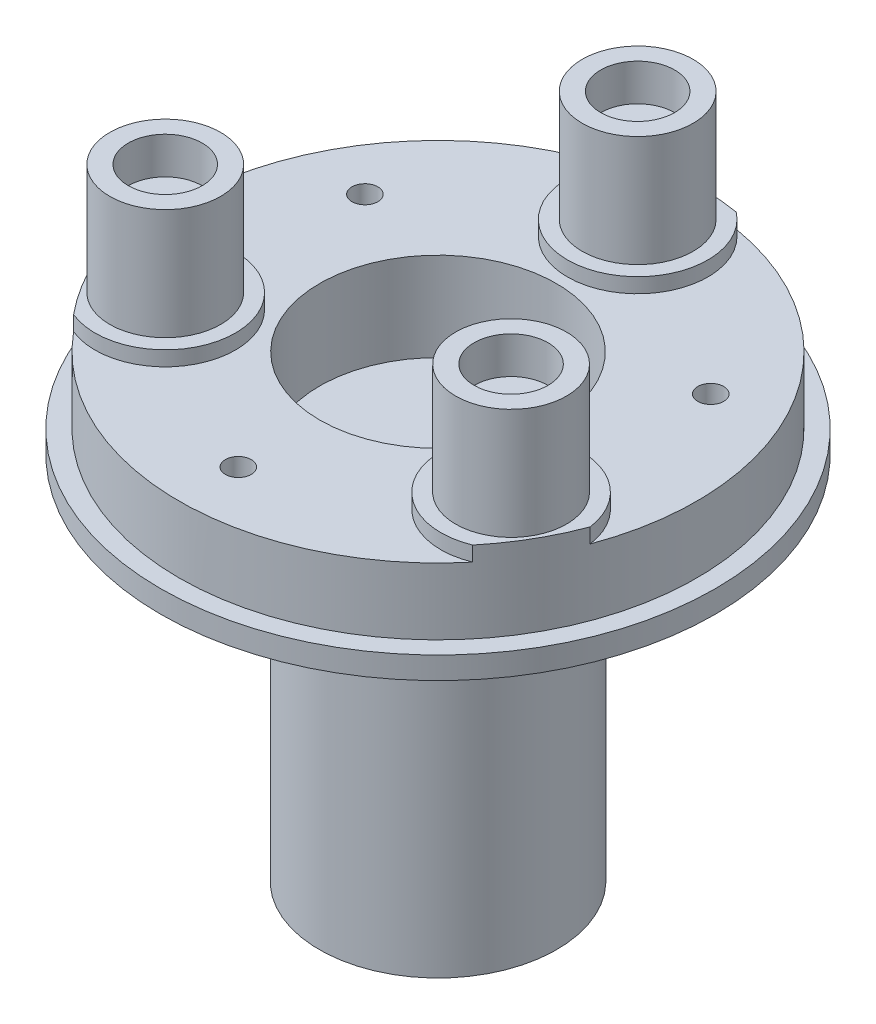
from build123d import *

# Parameters (mm, degrees)
SKETCH1_R                                     = 37.5
BOSS_EXTRUDE1_DEPTH                           = 3
SKETCH1_3_R                                   = 35
BOSS_EXTRUDE2_DEPTH                           = 12
SKETCH13_R                                    = 16
CUT_EXTRUDE6_DEPTH                            = 55.373706881
BOSS_EXTRUDE9_DEPTH                           = 2
SKETCH25_R                                    = 7.5
BOSS_EXTRUDE10_DEPTH                          = 15
SKETCH26_R                                    = 5
CUT_EXTRUDE9_DEPTH                            = 5
CBORE_FOR_M3_PAN_HEAD_MACHINE_SCREW1_AT_COUNT = 2
CBORE_FOR_M3_PAN_HEAD_MACHINE_SCREW1_AT_PITCH = 46.765371804
CBORE_FOR_M3_PAN_HEAD_MACHINE_SCREW1_2_COUNT  = 2
CBORE_FOR_M3_PAN_HEAD_MACHINE_SCREW1_2_PITCH  = 46.765371804
SKETCH29_R                                    = 1.75
CUT_EXTRUDE10_DEPTH                           = 56.691112397
SKETCH31_R                                    = 16.05
BOSS_EXTRUDE11_DEPTH                          = 50


with BuildPart() as part:
    # Sketch1 → Boss-Extrude1 (new body)
    with BuildSketch(Plane(origin=(0, 0, 0), x_dir=(1, 0, 0), z_dir=(0, 1, 0))):
        Circle(SKETCH1_R)
    extrude(amount=BOSS_EXTRUDE1_DEPTH)

    # Sketch1<3> → Boss-Extrude2 (add)
    with BuildSketch(Plane(origin=(0, 0, 0), x_dir=(1, 0, 0), z_dir=(0, 1, 0))):
        Circle(SKETCH1_3_R)
    extrude(amount=BOSS_EXTRUDE2_DEPTH)

    # Sketch13 → Cut-Extrude6 (cut, through all)
    with BuildSketch(Plane(origin=(0, 12, 0), x_dir=(1, 0, 0), z_dir=(0, 1, 0))):
        Circle(SKETCH13_R)
    extrude(amount=-CUT_EXTRUDE6_DEPTH, mode=Mode.SUBTRACT)

    # Sketch24 → Boss-Extrude9 (add)
    with BuildSketch(Plane(origin=(0, 12, 0), x_dir=(1, 0, 0), z_dir=(0, 1, 0))):
        with BuildLine():
            ThreePointArc((5.813043417, 34.513888889), (0, 35), (-5.813043417, 34.513888889))
            ThreePointArc((-5.813043417, 34.513888889), (0, 17.5), (5.813043417, 34.513888889))
        make_face()
        with BuildLine():
            ThreePointArc((-26.983382853, -22.291187717), (-15.155444566, -8.75), (-32.79642627, -12.222701172))
            ThreePointArc((-32.79642627, -12.222701172), (-30.310889132, -17.5), (-26.983382853, -22.291187717))
        make_face()
        with BuildLine():
            ThreePointArc((26.983382853, -22.291187717), (30.310889132, -17.5), (32.79642627, -12.222701172))
            ThreePointArc((32.79642627, -12.222701172), (15.155444566, -8.75), (26.983382853, -22.291187717))
        make_face()
    extrude(amount=BOSS_EXTRUDE9_DEPTH)

    # Sketch25 → Boss-Extrude10 (add)
    with BuildSketch(Plane(origin=(0, 14, 0), x_dir=(1, 0, 0), z_dir=(0, 1, 0))):
        with Locations((0, 27)):
            Circle(SKETCH25_R)
        with Locations((23.382685902, -13.5)):
            Circle(SKETCH25_R)
        with Locations((-23.382685902, -13.5)):
            Circle(SKETCH25_R)
    extrude(amount=BOSS_EXTRUDE10_DEPTH)

    # Sketch26 → Cut-Extrude9 (cut)
    with BuildSketch(Plane(origin=(0, 29, 0), x_dir=(1, 0, 0), z_dir=(0, 1, 0))):
        with Locations((0, 27)):
            Circle(SKETCH26_R)
        with Locations((23.382685902, -13.5)):
            Circle(SKETCH26_R)
        with Locations((-23.382685902, -13.5)):
            Circle(SKETCH26_R)
    extrude(amount=-CUT_EXTRUDE9_DEPTH, mode=Mode.SUBTRACT)

    # Sketch28 → CBORE for M3 Pan Head Machine Screw1 (revolve, cut)
    with BuildSketch(Plane(origin=(0, 0, -27), x_dir=(0, 0, -1), z_dir=(1, 0, 0))):
        Polygon((0, 0), (0, 29), (1.8, 29), (1.8, 2.4), (3.5, 2.4), (3.5, 0.025), (3.525, 0), align=None)
    cbore_for_m3_pan_head_machine_screw1 = revolve(axis=Axis((0, -6.35, -27), (0, 1, 0)), mode=Mode.SUBTRACT)

    # CBORE for M3 Pan Head Machine Screw1 at: CBORE for M3 Pan Head Machine Screw1 ×2
    with Locations(*[Vector(-0.5000000000000369, 0, 0.8660254037844174) * (i * CBORE_FOR_M3_PAN_HEAD_MACHINE_SCREW1_AT_PITCH) for i in range(1, CBORE_FOR_M3_PAN_HEAD_MACHINE_SCREW1_AT_COUNT)]):
        add(cbore_for_m3_pan_head_machine_screw1, mode=Mode.SUBTRACT)

    # CBORE for M3 Pan Head Machine Screw1 2: CBORE for M3 Pan Head Machine Screw1 ×2
    with Locations(*[Vector(0.49999999999996353, 0, 0.8660254037844598) * (i * CBORE_FOR_M3_PAN_HEAD_MACHINE_SCREW1_2_PITCH) for i in range(1, CBORE_FOR_M3_PAN_HEAD_MACHINE_SCREW1_2_COUNT)]):
        add(cbore_for_m3_pan_head_machine_screw1, mode=Mode.SUBTRACT)

    # Sketch29 → Cut-Extrude10 (cut, through all)
    with BuildSketch(Plane(origin=(0, 12, 0), x_dir=(1, 0, 0), z_dir=(0, 1, 0))):
        with Locations((23.382685902, 13.5)):
            Circle(SKETCH29_R)
        with Locations((0, -27)):
            Circle(SKETCH29_R)
        with Locations((-23.382685902, 13.5)):
            Circle(SKETCH29_R)
    extrude(amount=-CUT_EXTRUDE10_DEPTH, mode=Mode.SUBTRACT)


with BuildPart() as body_2:
    # Sketch31 → Boss-Extrude11 (new body)
    with BuildSketch(Plane.XZ):
        Circle(SKETCH31_R)
    extrude(amount=BOSS_EXTRUDE11_DEPTH)


solid = Compound([part.part, body_2.part])
